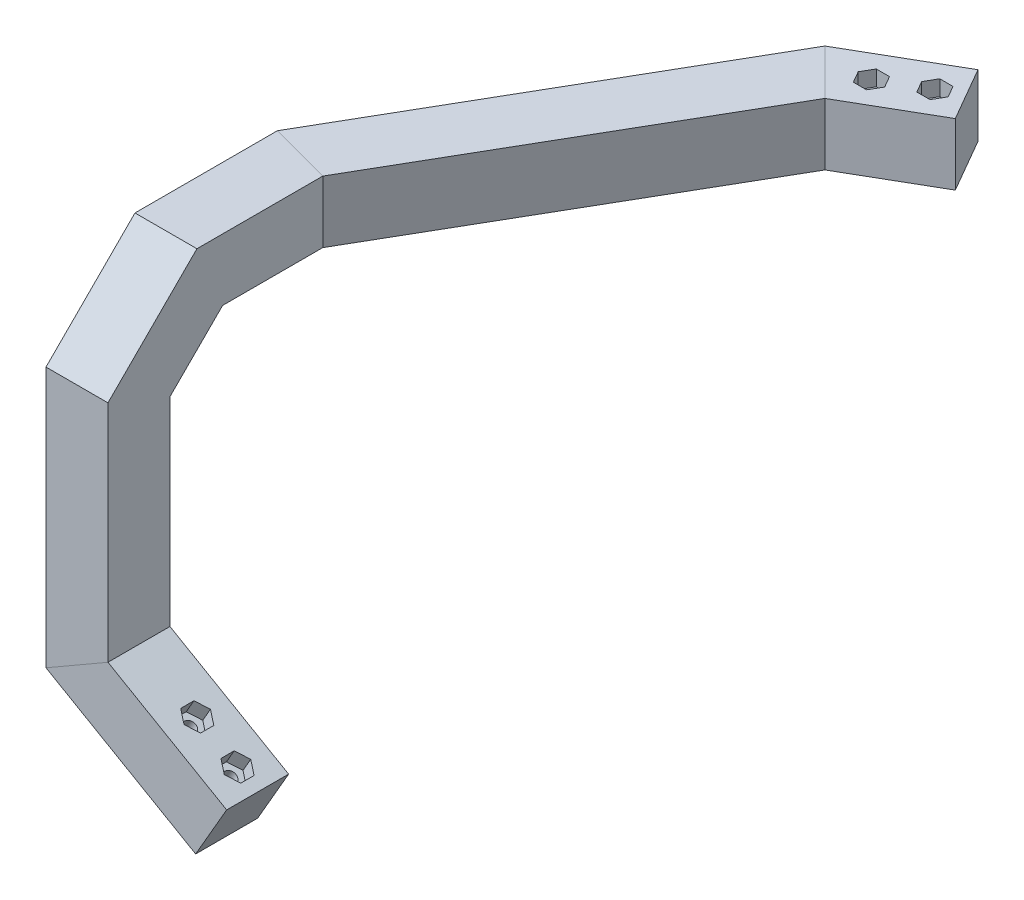
from build123d import *

# Parameters (mm, degrees)
SKETCH4_W           = 20
SKETCH4_H           = 20
SWEEP2_START        = -10
SWEEP2_OUTLINE_W    = 20
SWEEP2_OUTLINE_H    = 92
SWEEP2_DEPTH        = 20
SWEEP2_START_2      = -15
SWEEP2_2_OUTLINE_W  = 20
SWEEP2_2_OUTLINE_H  = 20
SWEEP2_2_DEPTH      = 5
SWEEP3_START        = 87
SWEEP3_DEPTH        = 20
CUT_EXTRUDE3_REACH  = 238.421
SKETCH5_R           = 2
SKETCH5_3_R         = 2
CUT_EXTRUDE4_DEPTH  = 5
CUT_EXTRUDE5_REACH  = 208.616
SKETCH6_R           = 2
SKETCH6_5_R         = 2
CUT_EXTRUDE6_DEPTH  = 5
CUT_EXTRUDE7_DEPTH  = 239.303090645
BOSS_EXTRUDE1_DEPTH = 20


# Read off the part's stored shape, not the designer's step: Sweep2, Sweep3
with BuildPart() as part:
    # Sweep1: sweep along a path in Sketch1
    with BuildLine(Plane.XY) as sweep1_path:
        Line((43.301270189, -25), (0, 0))
        Line((0, 0), (0, 15))
    # Sketch4 → Sweep1 (sweep)
    with BuildSketch(Plane(origin=(43.301270189, -25, 0), x_dir=(0, 0, -1), z_dir=(0.8660254037844382, -0.5000000000000011, 0))):
        Rectangle(SKETCH4_W, SKETCH4_H)
    sweep(path=sweep1_path.line, transition=Transition.RIGHT)

    # Sweep2 outline → Sweep2 (add)
    with BuildSketch(Plane.XY.offset(SWEEP2_START)):
        with Locations((0, 61)):
            Rectangle(SWEEP2_OUTLINE_W, SWEEP2_OUTLINE_H)
    extrude(amount=SWEEP2_DEPTH)

    # Sweep2 2 outline → Sweep2 2 (add)
    with BuildSketch(Plane.XY.offset(SWEEP2_START_2)):
        with Locations((0, 97)):
            Rectangle(SWEEP2_2_OUTLINE_W, SWEEP2_2_OUTLINE_H)
    extrude(amount=SWEEP2_2_DEPTH)

    # Sweep3 outline → Sweep3 (add)
    with BuildSketch(Plane(origin=(0, 0, 0), x_dir=(1, 0, 0), z_dir=(0, 1, 0)).offset(SWEEP3_START)):
        Polygon((54.679491924, 176.707658145), (-10, 64.679491924), (-10, 15), (10, 15), (10, 59.320508076), (69.320508076, 162.066641994), (96, 177.470053838), (86, 194.790561914), align=None)
    extrude(amount=SWEEP3_DEPTH)

    # Sketch5 → Cut-Extrude3 (cut, up to next)
    with BuildSketch(Plane(origin=(5, 8.660254038, 0), x_dir=(0.8660254037844382, -0.500000000000001, 0), z_dir=(0.5000000000000009, 0.866025403784438, 0)), mode=Mode.PRIVATE) as cut_extrude3_sk1:
        with Locations(Location((27.5, 0, 0), (0, 0, 180))):
            Circle(SKETCH5_R)
    cut_extrude3_tool1 = extrude(cut_extrude3_sk1.sketch, amount=-CUT_EXTRUDE3_REACH, mode=Mode.PRIVATE) & part.part
    # Sketch5 → Cut-Extrude3 (cut, up to next)
    with BuildSketch(Plane(origin=(5, 8.660254038, 0), x_dir=(0.8660254037844382, -0.500000000000001, 0), z_dir=(0.5000000000000009, 0.866025403784438, 0)), mode=Mode.PRIVATE) as cut_extrude3_sk2:
        with Locations(Location((42.5, 0, 0), (0, 0, 180))):
            Circle(SKETCH5_R)
    cut_extrude3_tool2 = extrude(cut_extrude3_sk2.sketch, amount=-CUT_EXTRUDE3_REACH, mode=Mode.PRIVATE) & part.part
    add(cut_extrude3_tool1.solids().sort_by_distance((28.815699, -5.089746, 0))[0], mode=Mode.SUBTRACT)
    add(cut_extrude3_tool2.solids().sort_by_distance((41.80608, -12.589746, 0))[0], mode=Mode.SUBTRACT)

    # Sketch5<3> → Cut-Extrude4 (cut)
    # profile 1 of 2: a face of its own
    with BuildSketch(Plane(origin=(5, 8.660254038, 0), x_dir=(0.8660254037844382, -0.500000000000001, 0), z_dir=(0.5000000000000009, 0.866025403784438, 0))):
        Polygon((31.2, -2.136195996), (31.2, 2.136195996), (27.5, 4.272391992), (23.8, 2.136195996), (23.8, -2.136195996), (27.5, -4.272391992), align=None)
        with Locations(Location((27.5, 0, 0), (0, 0, 180))):
            Circle(SKETCH5_3_R, mode=Mode.SUBTRACT)
    # profile 2 of 2: a face of its own
    with BuildSketch(Plane(origin=(5, 8.660254038, 0), x_dir=(0.8660254037844382, -0.500000000000001, 0), z_dir=(0.5000000000000009, 0.866025403784438, 0))):
        Polygon((46.2, -2.136195996), (46.2, 2.136195996), (42.5, 4.272391992), (38.8, 2.136195996), (38.8, -2.136195996), (42.5, -4.272391992), align=None)
        with Locations(Location((42.5, 0, 0), (0, 0, 180))):
            Circle(SKETCH5_3_R, mode=Mode.SUBTRACT)
    extrude(amount=-CUT_EXTRUDE4_DEPTH, mode=Mode.SUBTRACT)

    # Sketch6 → Cut-Extrude5 (cut, up to next)
    with BuildSketch(Plane(origin=(0, 107, -107), x_dir=(1, 0, 0), z_dir=(0, -1, 0)), mode=Mode.PRIVATE) as cut_extrude5_sk1:
        with Locations(Location((71.514428415, -67.880307876, 0), (0, 0, 90))):
            Circle(SKETCH6_R)
    cut_extrude5_tool1 = extrude(cut_extrude5_sk1.sketch, amount=CUT_EXTRUDE5_REACH, mode=Mode.PRIVATE) & part.part
    # Sketch6 → Cut-Extrude5 (cut, up to next)
    with BuildSketch(Plane(origin=(0, 107, -107), x_dir=(1, 0, 0), z_dir=(0, -1, 0)), mode=Mode.PRIVATE) as cut_extrude5_sk2:
        with Locations(Location((84.504809472, -75.380307876, 0), (0, 0, 90))):
            Circle(SKETCH6_R)
    cut_extrude5_tool2 = extrude(cut_extrude5_sk2.sketch, amount=CUT_EXTRUDE5_REACH, mode=Mode.PRIVATE) & part.part
    add(cut_extrude5_tool1.solids().sort_by_distance((71.514428, 107, -174.880308))[0], mode=Mode.SUBTRACT)
    add(cut_extrude5_tool2.solids().sort_by_distance((84.504809, 107, -182.380308))[0], mode=Mode.SUBTRACT)

    # Sketch6<5> → Cut-Extrude6 (cut)
    # profile 1 of 2: a face of its own
    with BuildSketch(Plane(origin=(0, 107, -107), x_dir=(1, 0, 0), z_dir=(0, -1, 0))):
        Polygon((75.786820407, -67.880307876), (73.650624411, -64.180307876), (69.378232419, -64.180307876), (67.242036423, -67.880307876), (69.378232419, -71.580307876), (73.650624411, -71.580307876), align=None)
        with Locations(Location((71.514428415, -67.880307876, 0), (0, 0, 90))):
            Circle(SKETCH6_5_R, mode=Mode.SUBTRACT)
    # profile 2 of 2: a face of its own
    with BuildSketch(Plane(origin=(0, 107, -107), x_dir=(1, 0, 0), z_dir=(0, -1, 0))):
        Polygon((88.777201464, -75.380307876), (86.641005468, -71.680307876), (82.368613476, -71.680307876), (80.23241748, -75.380307876), (82.368613476, -79.080307876), (86.641005468, -79.080307876), align=None)
        with Locations(Location((84.504809472, -75.380307876, 0), (0, 0, 90))):
            Circle(SKETCH6_5_R, mode=Mode.SUBTRACT)
    extrude(amount=CUT_EXTRUDE6_DEPTH, mode=Mode.SUBTRACT)

    # Sketch7 → Cut-Extrude7 (cut, through all)
    with BuildSketch(Plane(origin=(10, 0, 0), x_dir=(0, 0, -1), z_dir=(1, 0, 0))):
        Polygon((4.356747298, 92.643252702), (-10, 107), (-10, 78.286505404), align=None)
        Polygon((18.713494596, 107), (-10, 107), (4.356747298, 92.643252702), align=None)
    extrude(amount=-CUT_EXTRUDE7_DEPTH, mode=Mode.SUBTRACT)

    # Sketch7<3> → Boss-Extrude1 (add, through all)
    with BuildSketch(Plane(origin=(10, 0, 0), x_dir=(0, 0, -1), z_dir=(1, 0, 0))):
        Polygon((26.997765843, 87), (10, 87), (10, 70.002234157), align=None)
    extrude(amount=-BOSS_EXTRUDE1_DEPTH)


solid = part.part
